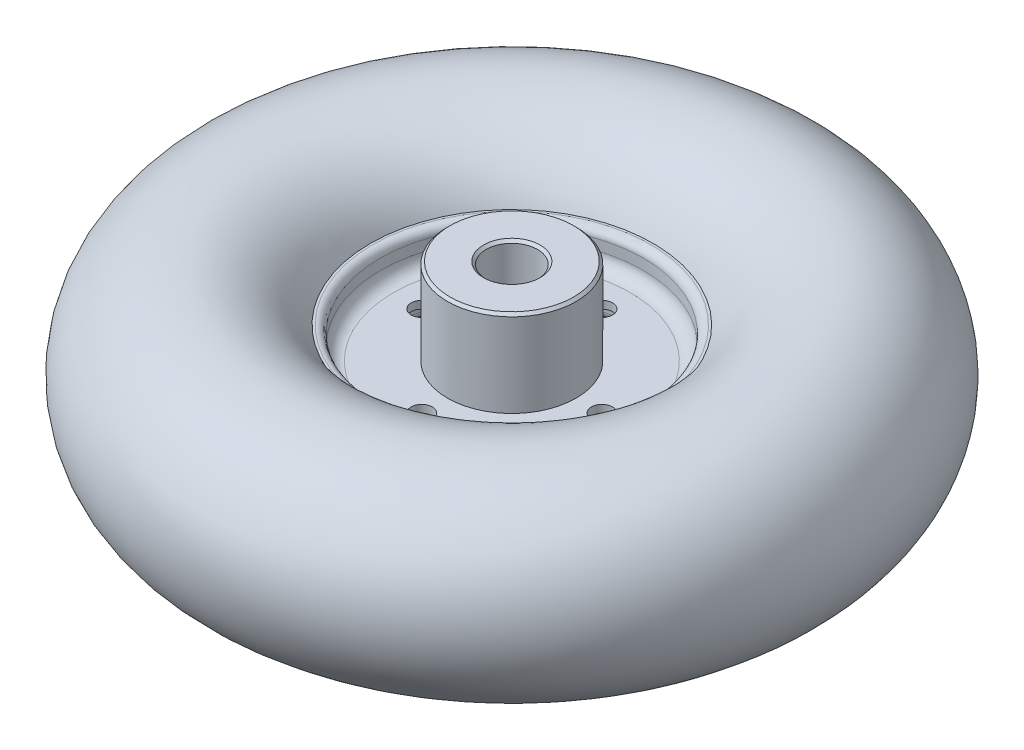
from build123d import *

# Parameters (mm, degrees)
SKETCH_1_R               = 38.5
SKETCH_1_W               = 10
SKETCH_1_H               = 30
SKETCH_1_W_2             = 41
SKETCH_1_H_2             = 3
FILLET_1_R               = 3
FILLET_2_R               = 5
EXTRUDE_1_DEPTH          = 35
EXTRUDE_1_DEPTH_BACK     = 35
SKETCH_3_R               = 25
SKETCH_3_R_2             = 10
CHAMFER_1_SIZE           = 1
SKETCH_4_R               = 4.1
CUT_EXTRUDE_1_DEPTH      = 10
PATTERN_CIRCULAR_1_COUNT = 4


with BuildPart() as part:
    # 草图1 → 旋转1 (revolve)
    with BuildSketch(Plane.XY, mode=Mode.PRIVATE) as revolve_1_sk:
        with Locations((89.5, -9.867711256)):
            Circle(SKETCH_1_R)
        with Locations((56, -8.053766518)):
            Rectangle(SKETCH_1_W, SKETCH_1_H)
        with Locations((30.5, -6.673002614)):
            Rectangle(SKETCH_1_W_2, SKETCH_1_H_2)
    revolve(revolve_1_sk.sketch.rotate(Axis((0, 112.941993014, 0), (0, -1, 0)), 180), axis=Axis((0, 112.941993014, 0), (0, -1, 0)))

    # 圆角1
    # the kernel refuses this fillet: 3 mm, written as the material it takes off along each edge
    with BuildSketch(Plane(origin=(0, -23.053766518, 0), x_dir=(-1, 0, 0), z_dir=(0, 0, 1))) as fillet_1_piece_1:
        with BuildLine():
            CenterArc((54, -2.923880611), FILLET_1_R, 102.934428201, 77.065571799)
            Line((51, -2.923880611), (50.94, -2.923880611))
            Line((50.94, -2.923880611), (50.94, 0))
            Line((50.94, 0), (51, 0.06))
            ThreePointArc((51, 0.06), (52.164246307, 0.06), (53.315062466, 0.058477612))
            Line((53.315062466, 0.058477612), (53.328492613, 0))
        make_face()
    revolve(axis=Axis((0, -23.053766518, 0), (0, -1, 0)), mode=Mode.SUBTRACT)
    with BuildSketch(Plane(origin=(0, 6.946233482, 0), x_dir=(-1, 0, 0), z_dir=(0, 0, 1))) as fillet_1_piece_2:
        with BuildLine():
            CenterArc((51 + FILLET_1_R, FILLET_1_R), FILLET_1_R, 180, 90)
            Line((51, FILLET_1_R), (51 - FILLET_1_R * 0.02, FILLET_1_R))
            Line((51 - FILLET_1_R * 0.02, FILLET_1_R), (51 - FILLET_1_R * 0.02, -FILLET_1_R * 0.02))
            Line((51 - FILLET_1_R * 0.02, -FILLET_1_R * 0.02), (51 + FILLET_1_R, -FILLET_1_R * 0.02))
            Line((51 + FILLET_1_R, -FILLET_1_R * 0.02), (51 + FILLET_1_R, 0))
        make_face()
    revolve(axis=Axis((0, 6.946233482, 0), (0, -1, 0)), mode=Mode.SUBTRACT)

    # 圆角2
    fillet_2_edges = [part.edges().sort_by_distance(p)[0] for p in [
        (51, -8.173002614, 0),
        (51, -5.173002614, 0),
    ]]
    fillet(fillet_2_edges, radius=FILLET_2_R)

    # 草图3 → 凸台-拉伸1 (add, two sides: drawn at the far end of the back side and taken through both)
    with BuildSketch(Plane(origin=(0, -6.673002614, 0), x_dir=(-1, 0, 0), z_dir=(0, -1, 0)).offset(-EXTRUDE_1_DEPTH_BACK)):
        with Locations(Location((0, 0, 0), (0, 0, 180))):
            Circle(SKETCH_3_R)
        with Locations(Location((0, 0, 0), (0, 0, 180))):
            Circle(SKETCH_3_R_2, mode=Mode.SUBTRACT)
    extrude(amount=EXTRUDE_1_DEPTH + EXTRUDE_1_DEPTH_BACK)

    # 倒角1
    chamfer_1_edges = [part.edges().sort_by_distance(p)[0] for p in [
        (-10, -41.673002614, 0),
        (-25, 28.326997386, 0),
        (-10, 28.326997386, 0),
        (-25, -41.673002614, 0),
    ]]
    chamfer(chamfer_1_edges, length=CHAMFER_1_SIZE)

    # 草图4 → 切除-拉伸1 (cut)
    with BuildSketch(Plane(origin=(0, -5.173002614, 0), x_dir=(1, 0, 0), z_dir=(0, 1, 0))):
        with Locations(Location((35, 0, 0), (0, 0, 180))):
            Circle(SKETCH_4_R)
    cut_extrude_1 = extrude(amount=-CUT_EXTRUDE_1_DEPTH, mode=Mode.SUBTRACT)

    # 阵列(圆周)1: 切除-拉伸1 ×4 about axis
    pattern_circular_1_axis = Axis((0, 0, 0), (0, 1, 0))
    for i in range(1, PATTERN_CIRCULAR_1_COUNT):
        add(cut_extrude_1.rotate(pattern_circular_1_axis, i * 360 / PATTERN_CIRCULAR_1_COUNT), mode=Mode.SUBTRACT)


solid = part.part
